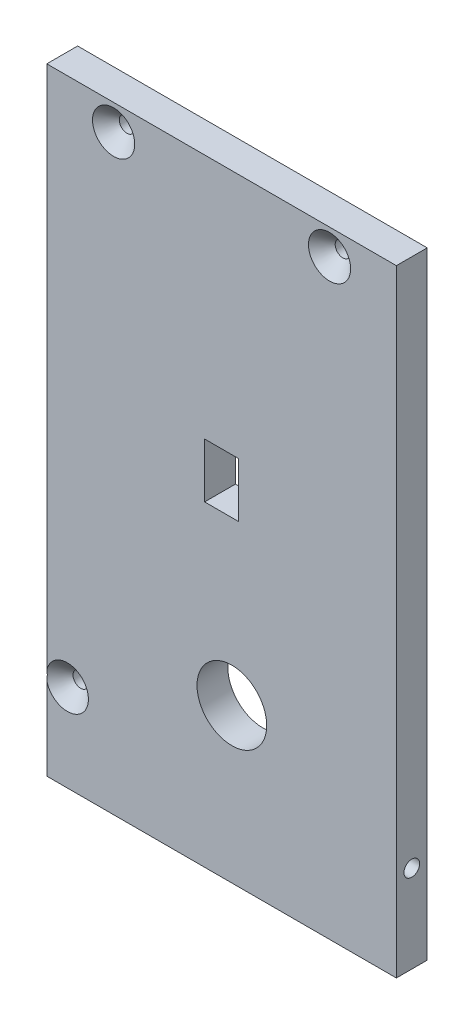
from build123d import *

# Parameters (mm, degrees)
SKETCH1_W           = 34
SKETCH1_H           = 60
SKETCH1_R           = 0.75
BOSS_EXTRUDE1_DEPTH = 3
CHAMFER1_SIZE       = 1.3
SKETCH2_R           = 0.762
CUT_EXTRUDE1_DEPTH  = 7
SKETCH3_W           = 5
SKETCH3_H           = 4.4
CUT_EXTRUDE2_DEPTH  = 1.7
SKETCH4_R           = 0.762
CUT_EXTRUDE3_DEPTH  = 7
SKETCH5_W           = 3.3
SKETCH5_H           = 5.3
CUT_EXTRUDE4_DEPTH  = 3.5
SKETCH7_R           = 0.762
SKETCH7_W           = 7
SKETCH7_H           = 5.3
CUT_EXTRUDE5_DEPTH  = 2.5
SKETCH8_W           = 1.8
SKETCH8_H           = 17.3
CUT_EXTRUDE6_DEPTH  = 2.5
SKETCH9_R           = 3.39
CUT_EXTRUDE7_DEPTH  = 7.5


with BuildPart() as part:
    # Sketch1 → Boss-Extrude1 (new body)
    with BuildSketch(Plane.XY):
        Rectangle(SKETCH1_W, SKETCH1_H)
        with Locations((-15, -21.5)):
            Circle(SKETCH1_R, mode=Mode.SUBTRACT)
        with Locations(Location((-10.5, 27.5, 0), (0, 0, 180))):
            Circle(SKETCH1_R, mode=Mode.SUBTRACT)
        with Locations((10.5, 27.5)):
            Circle(SKETCH1_R, mode=Mode.SUBTRACT)
    extrude(amount=BOSS_EXTRUDE1_DEPTH)

    # Chamfer1
    # the kernel refuses this chamfer: 1.3 mm, written as the material it takes off along each edge
    with BuildSketch(Plane(origin=(-15, -21.5, 3), x_dir=(1, 0, 0), z_dir=(0, -1, 0))) as chamfer1_piece_1:
        Polygon((0.75, -CHAMFER1_SIZE), (0.75 + CHAMFER1_SIZE, 0), (0.75, 0), align=None)
    revolve(axis=Axis((-15, -21.5, 3), (0, 0, 1)), mode=Mode.SUBTRACT)
    with BuildSketch(Plane(origin=(-10.5, 27.5, 3), x_dir=(-1, 0, 0), z_dir=(0, 1, 0))) as chamfer1_piece_2:
        Polygon((0.75, -CHAMFER1_SIZE), (0.75 + CHAMFER1_SIZE, 0), (0.75, 0), align=None)
    revolve(axis=Axis((-10.5, 27.5, 3), (0, 0, 1)), mode=Mode.SUBTRACT)
    with BuildSketch(Plane(origin=(10.5, 27.5, 3), x_dir=(1, 0, 0), z_dir=(0, -1, 0))) as chamfer1_piece_3:
        Polygon((0.75, -CHAMFER1_SIZE), (0.75 + CHAMFER1_SIZE, 0), (0.75, 0), align=None)
    revolve(axis=Axis((10.5, 27.5, 3), (0, 0, 1)), mode=Mode.SUBTRACT)

    # Sketch2 → Cut-Extrude1 (cut)
    with BuildSketch(Plane(origin=(17, 0, 0), x_dir=(0, 0, -1), z_dir=(1, 0, 0))):
        with Locations((-1.5, -21.5)):
            Circle(SKETCH2_R)
    extrude(amount=-CUT_EXTRUDE1_DEPTH, mode=Mode.SUBTRACT)

    # Sketch3 → Cut-Extrude2 (cut)
    with BuildSketch(Plane(origin=(0, 0, 0), x_dir=(-1, 0, 0), z_dir=(0, 0, -1))):
        Polygon((3.765333438, -30), (12, -30), (12, -24.8), (7, -24.8), (3.765333438, -24.8), align=None)
        with Locations((9.5, -22.6)):
            Rectangle(SKETCH3_W, SKETCH3_H)
    extrude(amount=-CUT_EXTRUDE2_DEPTH, mode=Mode.SUBTRACT)

    # Sketch4 → Cut-Extrude3 (cut)
    with BuildSketch(Plane.XZ.offset(30)):
        with Locations(Location((15, 1.5, 0), (0, 0, 270))):
            Circle(SKETCH4_R)
    extrude(amount=-CUT_EXTRUDE3_DEPTH, mode=Mode.SUBTRACT)

    # Sketch5 → Cut-Extrude4 (cut)
    with BuildSketch(Plane(origin=(0, 0, 0), x_dir=(-1, 0, 0), z_dir=(0, 0, -1))):
        with Locations((0, 3.425)):
            Rectangle(SKETCH5_W, SKETCH5_H)
    extrude(amount=-CUT_EXTRUDE4_DEPTH, mode=Mode.SUBTRACT)

    # Sketch7 → Cut-Extrude5 (cut)
    with BuildSketch(Plane(origin=(0, 0, 0), x_dir=(-1, 0, 0), z_dir=(0, 0, -1))):
        with Locations((-10.25, 13.75)):
            Circle(SKETCH7_R)
        with Locations((10.25, 13.75)):
            Circle(SKETCH7_R)
        with Locations(Location((10.25, -6.9, 0), (0, 0, 180))):
            Circle(SKETCH7_R)
        with Locations(Location((-10.25, -6.9, 0), (0, 0, 180))):
            Circle(SKETCH7_R)
        with Locations((0, 13.2)):
            Rectangle(SKETCH7_W, SKETCH7_H)
        with Locations((0, -6.35)):
            Rectangle(SKETCH7_W, SKETCH7_H)
    extrude(amount=-CUT_EXTRUDE5_DEPTH, mode=Mode.SUBTRACT)

    # Sketch8 → Cut-Extrude6 (cut)
    with BuildSketch(Plane(origin=(0, 0, 0), x_dir=(-1, 0, 0), z_dir=(0, 0, -1))):
        with Locations((11.8, 3.53)):
            Rectangle(SKETCH8_W, SKETCH8_H)
        with Locations((-11.8, 3.53)):
            Rectangle(SKETCH8_W, SKETCH8_H)
    extrude(amount=-CUT_EXTRUDE6_DEPTH, mode=Mode.SUBTRACT)

    # Sketch9 → Cut-Extrude7 (cut)
    with BuildSketch(Plane(origin=(0, 0, 0), x_dir=(-1, 0, 0), z_dir=(0, 0, -1))):
        with Locations((-1, -15.04)):
            Circle(SKETCH9_R)
    extrude(amount=-CUT_EXTRUDE7_DEPTH, mode=Mode.SUBTRACT)


solid = part.part
